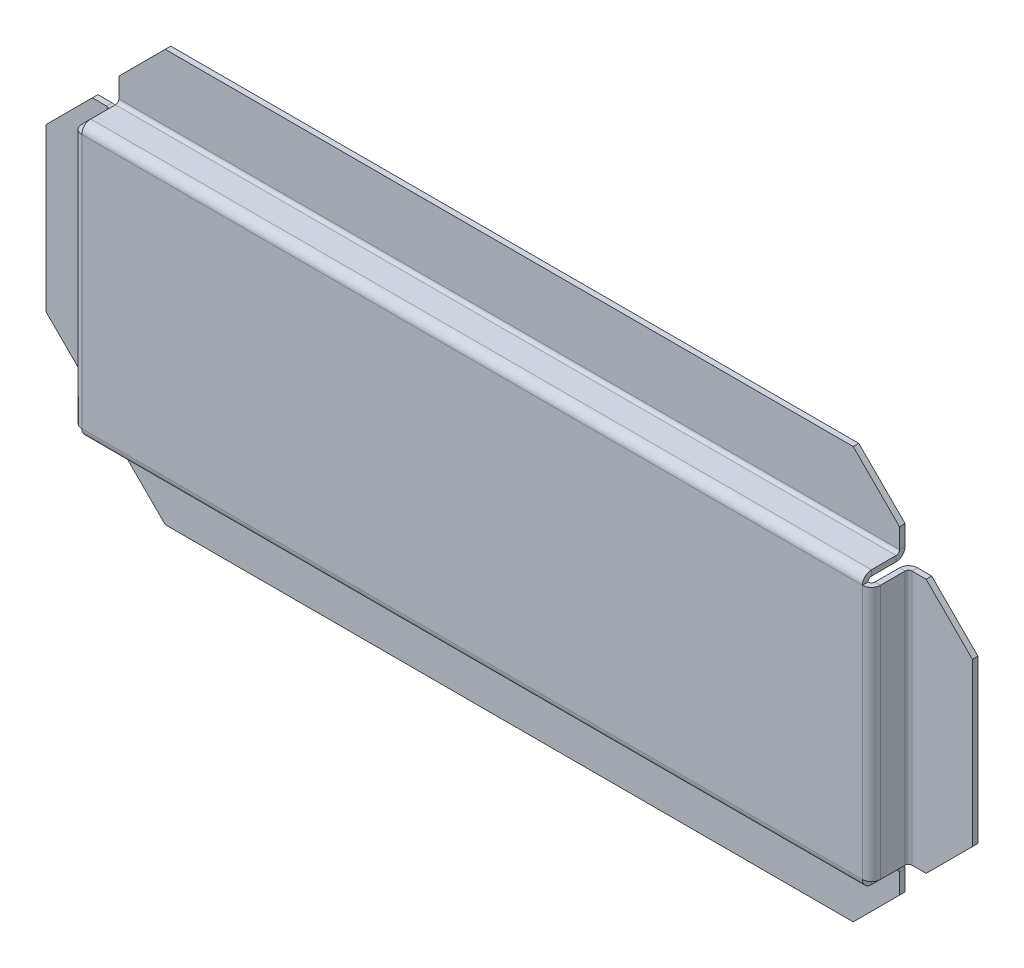
from build123d import *

# Parameters (mm, degrees)
BASE_FLANGE1_DEPTH           = 55
EDGE_FLANGE1_DEPTH           = 168.5268
EDGE_FLANGE2_STRIP_W         = 6.2732
EDGE_FLANGE2_STRIP_H         = 1.2
EDGE_FLANGE2_STRIP_CUT_DEPTH = 168.5268
EDGE_FLANGE2_DEPTH           = 168.5268
EDGE_FLANGE3_DEPTH           = 168.5268
EDGE_FLANGE4_STRIP_W         = 6.2732
EDGE_FLANGE4_STRIP_H         = 1.2
EDGE_FLANGE4_STRIP_CUT_DEPTH = 168.5268
EDGE_FLANGE4_DEPTH           = 168.5268
CHAMFER1_SIZE                = 10


# Sheet-metal steps are written as plain solids
with BuildPart() as part:
    # Sketch1 → Base-Flange1 (new body)
    with BuildSketch(Plane(origin=(0, 0, 0), x_dir=(1, 0, 0), z_dir=(0, 1, 0))):
        with BuildLine():
            Line((-76.471389646, 0), (-63.407989646, 0))
            ThreePointArc((-63.407989646, 0), (-62.038606653, -0.567217008), (-61.471389646, -1.9366))
            Line((-61.471389646, -1.9366), (-61.471389646, -7.2634))
            ThreePointArc((-61.471389646, -7.2634), (-61.255644501, -7.784254855), (-60.734789646, -8))
            Line((-60.734789646, -8), (107.792010354, -8))
            ThreePointArc((107.792010354, -8), (108.312865209, -7.784254855), (108.528610354, -7.2634))
            Line((108.528610354, -7.2634), (108.528610354, -1.9366))
            ThreePointArc((108.528610354, -1.9366), (109.095827362, -0.567217008), (110.465210354, 0))
            Line((110.465210354, 0), (123.528610354, 0))
            Line((123.528610354, 0), (123.528610354, -1.2))
            Line((123.528610354, -1.2), (110.465210354, -1.2))
            ThreePointArc((110.465210354, -1.2), (109.944355499, -1.415745145), (109.728610354, -1.9366))
            Line((109.728610354, -1.9366), (109.728610354, -7.2634))
            ThreePointArc((109.728610354, -7.2634), (109.161393347, -8.632782992), (107.792010354, -9.2))
            Line((107.792010354, -9.2), (-60.734789646, -9.2))
            ThreePointArc((-60.734789646, -9.2), (-62.104172638, -8.632782992), (-62.671389646, -7.2634))
            Line((-62.671389646, -7.2634), (-62.671389646, -1.9366))
            ThreePointArc((-62.671389646, -1.9366), (-62.887134791, -1.415745145), (-63.407989646, -1.2))
            Line((-63.407989646, -1.2), (-76.471389646, -1.2))
            Line((-76.471389646, -1.2), (-76.471389646, 0))
        make_face()
    extrude(amount=BASE_FLANGE1_DEPTH)

    # Edge-Flange1 section (across the edge) → Edge-Flange1 (add)
    with BuildSketch(Plane(origin=(-60.734789646, 55.7366, 8), x_dir=(0, -1, 0), z_dir=(1, 0, 0))):
        with BuildLine():
            Line((-1.2, 0.7366), (-1.2, 8))
            Line((-1.2, 8), (0, 8))
            Line((0, 8), (0, 0.7366))
            ThreePointArc((0, 0.7366), (0.215745145, 0.215745145), (0.7366, 0))
            Line((0.7366, 0), (0.7366, -1.2))
            ThreePointArc((0.7366, -1.2), (-0.632782992, -0.632782992), (-1.2, 0.7366))
        make_face()
    extrude(amount=EDGE_FLANGE1_DEPTH)

    # Edge-Flange2 strip (across the edge) → Edge-Flange2 strip cut (cut)
    with BuildSketch(Plane(origin=(107.792010354, 56.9366, 0), x_dir=(0, 0, 1), z_dir=(-1, 0, 0))):
        with Locations((-1.2, -0.6)):
            Rectangle(EDGE_FLANGE2_STRIP_W, EDGE_FLANGE2_STRIP_H)
    extrude(amount=EDGE_FLANGE2_STRIP_CUT_DEPTH, mode=Mode.SUBTRACT)

    # Edge-Flange2 section (across the edge) → Edge-Flange2 (add)
    with BuildSketch(Plane(origin=(107.792010354, 56.9366, 0), x_dir=(0, 0, 1), z_dir=(-1, 0, 0))):
        with BuildLine():
            Line((0, 0.7366), (0, 15))
            Line((0, 15), (1.2, 15))
            Line((1.2, 15), (1.2, 0.7366))
            ThreePointArc((1.2, 0.7366), (1.415745145, 0.215745145), (1.9366, 0))
            Line((1.9366, 0), (1.9366, -1.2))
            ThreePointArc((1.9366, -1.2), (0.567217008, -0.632782992), (0, 0.7366))
        make_face()
    extrude(amount=EDGE_FLANGE2_DEPTH)

    # Edge-Flange3 section (across the edge) → Edge-Flange3 (add)
    with BuildSketch(Plane(origin=(107.792010354, -0.7366, 8), x_dir=(0, 1, 0), z_dir=(-1, 0, 0))):
        with BuildLine():
            Line((-1.2, 0.7366), (-1.2, 8))
            Line((-1.2, 8), (0, 8))
            Line((0, 8), (0, 0.7366))
            ThreePointArc((0, 0.7366), (0.215745145, 0.215745145), (0.7366, 0))
            Line((0.7366, 0), (0.7366, -1.2))
            ThreePointArc((0.7366, -1.2), (-0.632782992, -0.632782992), (-1.2, 0.7366))
        make_face()
    extrude(amount=EDGE_FLANGE3_DEPTH)

    # Edge-Flange4 strip (across the edge) → Edge-Flange4 strip cut (cut)
    with BuildSketch(Plane(origin=(-60.734789646, -1.9366, 0), x_dir=(0, 0, 1), z_dir=(1, 0, 0))):
        with Locations((-1.2, -0.6)):
            Rectangle(EDGE_FLANGE4_STRIP_W, EDGE_FLANGE4_STRIP_H)
    extrude(amount=EDGE_FLANGE4_STRIP_CUT_DEPTH, mode=Mode.SUBTRACT)

    # Edge-Flange4 section (across the edge) → Edge-Flange4 (add)
    with BuildSketch(Plane(origin=(-60.734789646, -1.9366, 0), x_dir=(0, 0, 1), z_dir=(1, 0, 0))):
        with BuildLine():
            Line((0, 0.7366), (0, 15))
            Line((0, 15), (1.2, 15))
            Line((1.2, 15), (1.2, 0.7366))
            ThreePointArc((1.2, 0.7366), (1.415745145, 0.215745145), (1.9366, 0))
            Line((1.9366, 0), (1.9366, -1.2))
            ThreePointArc((1.9366, -1.2), (0.567217008, -0.632782992), (0, 0.7366))
        make_face()
    extrude(amount=EDGE_FLANGE4_DEPTH)

    # Chamfer1
    chamfer1_edges = [part.edges().sort_by_distance(p)[0] for p in [
        (107.792010354, 71.9366, 0.6),
        (-60.734789646, 71.9366, 0.6),
        (-60.734789646, -16.9366, 0.6),
        (107.792010354, -16.9366, 0.6),
        (-76.471389646, 0, 0.6),
        (123.528610354, 0, 0.6),
        (-76.471389646, 55, 0.6),
        (123.528610354, 55, 0.6),
    ]]
    chamfer(chamfer1_edges, length=CHAMFER1_SIZE)


solid = part.part
